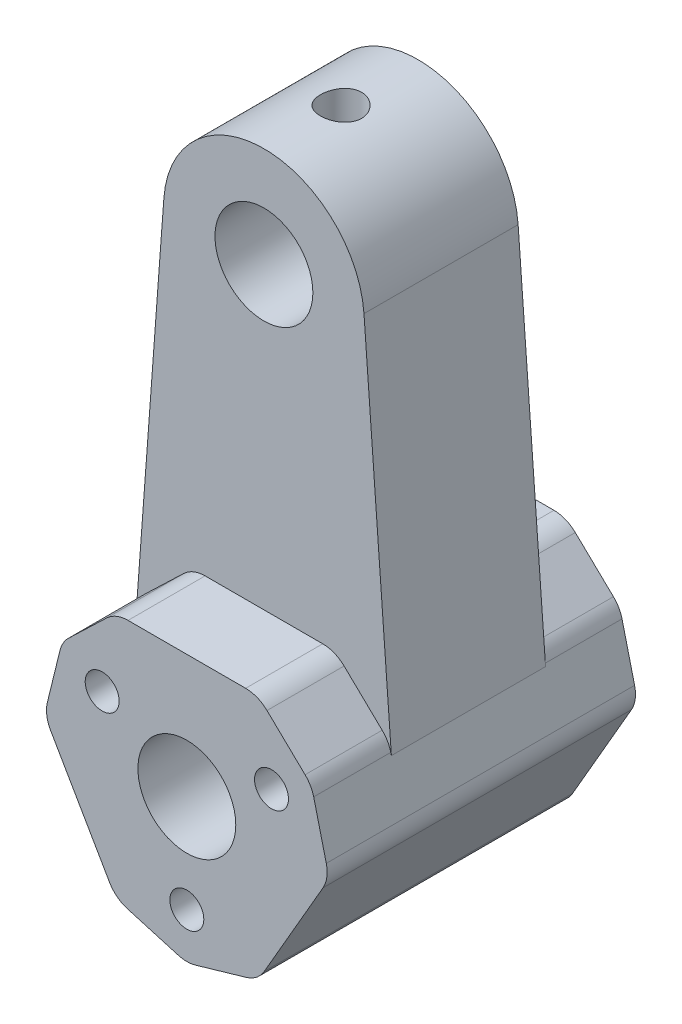
from build123d import *

# Parameters (mm, degrees)
SKETCH1_R           = 4.7625
SKETCH1_R_2         = 1.65
BOSS_EXTRUDE1_DEPTH = 15
SKETCH2_R           = 4.7625
BOSS_EXTRUDE2_DEPTH = 7.5
CUT_EXTRUDE1_REACH  = 69.858
SKETCH3_R           = 2


with BuildPart() as part:
    # Sketch1 → Boss-Extrude1 (new, symmetric)
    with BuildSketch(Plane.XY):
        with BuildLine():
            Line((-13.253372163, -1.044486042), (-7.531237528, -10.955513958))
            ThreePointArc((-7.531237528, -10.955513958), (-6.784217233, -11.816359568), (-5.770008435, -12.336431676))
            Line((-5.770008435, -12.336431676), (-0.836847118, -13.76941319))
            ThreePointArc((-0.836847118, -13.76941319), (0, -13.888495471), (0.836847118, -13.76941319))
            Line((0.836847118, -13.76941319), (5.770008435, -12.336431676))
            ThreePointArc((5.770008435, -12.336431676), (6.784217233, -11.816359568), (7.531237528, -10.955513958))
            Line((7.531237528, -10.955513958), (13.253372163, -1.044486042))
            ThreePointArc((13.253372163, -1.044486042), (13.625376182, 0.032875315), (13.568667441, 1.171241953))
            Line((13.568667441, 1.171241953), (12.343085176, 6.159975731))
            ThreePointArc((12.343085176, 6.159975731), (12.027789898, 6.944247736), (11.506238058, 7.609437458))
            Line((11.506238058, 7.609437458), (7.798659006, 11.165189723))
            ThreePointArc((7.798659006, 11.165189723), (6.841158949, 11.783484253), (5.722134635, 12))
            Line((5.722134635, 12), (-5.722134635, 12))
            ThreePointArc((-5.722134635, 12), (-6.841158949, 11.783484253), (-7.798659006, 11.165189723))
            Line((-7.798659006, 11.165189723), (-11.506238058, 7.609437458))
            ThreePointArc((-11.506238058, 7.609437458), (-12.027789898, 6.944247736), (-12.343085176, 6.159975731))
            Line((-12.343085176, 6.159975731), (-13.568667441, 1.171241953))
            ThreePointArc((-13.568667441, 1.171241953), (-13.625376182, 0.032875315), (-13.253372163, -1.044486042))
        make_face()
        Circle(SKETCH1_R, mode=Mode.SUBTRACT)
        with Locations((-8.238066653, 4.75625)):
            Circle(SKETCH1_R_2, mode=Mode.SUBTRACT)
        with Locations((8.238066653, 4.75625)):
            Circle(SKETCH1_R_2, mode=Mode.SUBTRACT)
        with Locations((0, -9.5125)):
            Circle(SKETCH1_R_2, mode=Mode.SUBTRACT)
    extrude(amount=BOSS_EXTRUDE1_DEPTH, both=True)

    # Sketch2 → Boss-Extrude2 (add, symmetric)
    with BuildSketch(Plane.XY):
        with BuildLine():
            Line((-12.421472807, 5.666457921), (-9.735682804, 41.826981922))
            ThreePointArc((-9.735682804, 41.826981922), (0, 50.866372944), (9.735682804, 41.826981922))
            Line((9.735682804, 41.826981922), (12.421472807, 5.666457921))
            Line((12.421472807, 5.666457921), (0, 12))
            Line((0, 12), (-12.421472807, 5.666457921))
        make_face()
        with Locations((0, 41.103872944)):
            Circle(SKETCH2_R, mode=Mode.SUBTRACT)
    extrude(amount=BOSS_EXTRUDE2_DEPTH, both=True)

    # Sketch3 → Cut-Extrude1 (cut, up to next)
    with BuildSketch(Plane(origin=(0, 50.866372944, 0), x_dir=(1, 0, 0), z_dir=(0, 1, 0)), mode=Mode.PRIVATE) as cut_extrude1_sk1:
        Circle(SKETCH3_R)
    cut_extrude1_tool1 = extrude(cut_extrude1_sk1.sketch, amount=-CUT_EXTRUDE1_REACH, mode=Mode.PRIVATE) & part.part
    add(cut_extrude1_tool1.solids().sort_by_distance((0, 50.866373, 0))[0], mode=Mode.SUBTRACT)


solid = part.part
